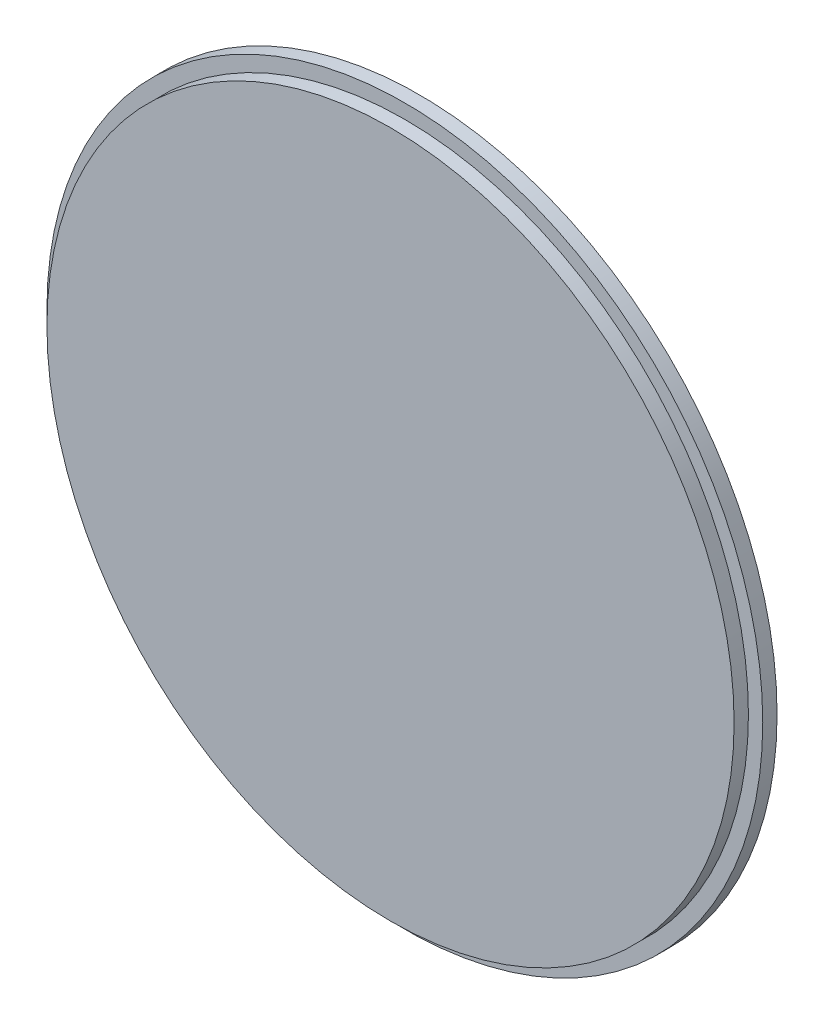
from build123d import *

# Parameters (mm, degrees)
SKETCH1_R           = 79.375
BOSS_EXTRUDE1_DEPTH = 3.175
SKETCH2_R           = 76.2
BOSS_EXTRUDE2_DEPTH = 3.175


with BuildPart() as part:
    # Sketch1 → Boss-Extrude1 (new body)
    with BuildSketch(Plane.XY):
        Circle(SKETCH1_R)
    extrude(amount=BOSS_EXTRUDE1_DEPTH)

    # Sketch2 → Boss-Extrude2 (add)
    with BuildSketch(Plane.XY.offset(3.175)):
        Circle(SKETCH2_R)
    extrude(amount=BOSS_EXTRUDE2_DEPTH)


solid = part.part
